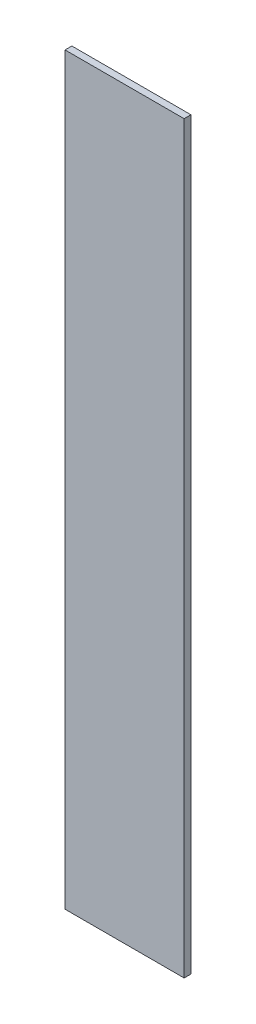
from build123d import *

# Parameters (mm, degrees)
SKETCH1_W           = 28
SKETCH1_H           = 175
BOSS_EXTRUDE1_DEPTH = 1.6


with BuildPart() as part:
    # Sketch1 → Boss-Extrude1 (new body)
    with BuildSketch(Plane.XY):
        with Locations((0, 87.5)):
            Rectangle(SKETCH1_W, SKETCH1_H)
    extrude(amount=BOSS_EXTRUDE1_DEPTH)


solid = part.part
